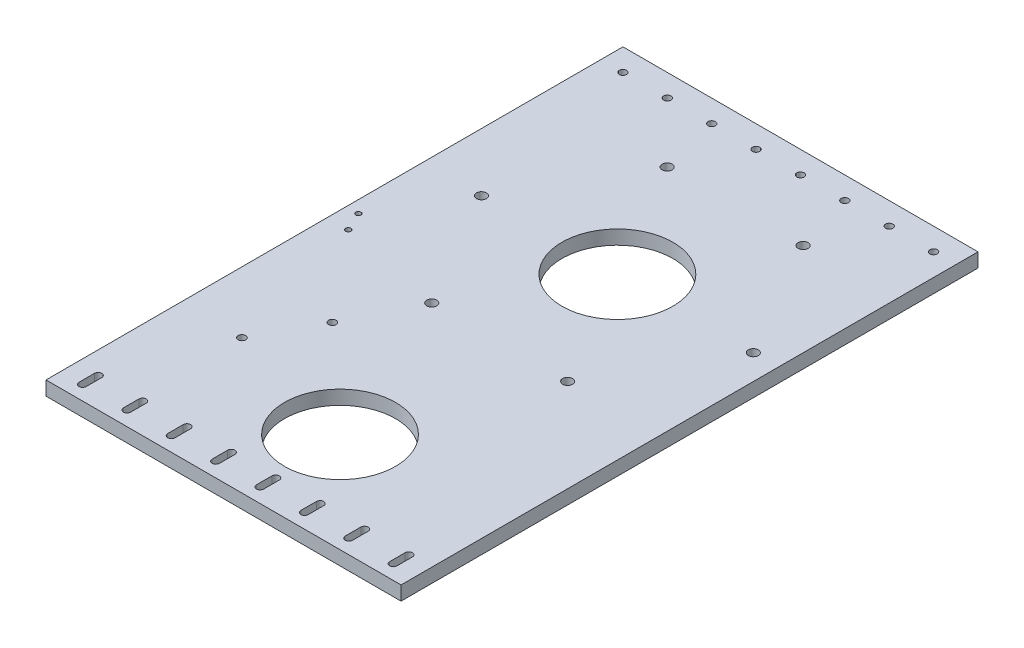
from build123d import *

# Parameters (mm, degrees)
SKETCH1_W           = 160
SKETCH1_H           = 260
SKETCH1_R           = 1.175
SKETCH1_R_2         = 2.25
SKETCH1_R_3         = 25
SKETCH1_R_4         = 1.65
BOSS_EXTRUDE1_DEPTH = 6.35
SKETCH2_R           = 1.7
CUT_EXTRUDE1_DEPTH  = 306.352783678


with BuildPart() as part:
    # Sketch1 → Boss-Extrude1 (new body)
    with BuildSketch(Plane(origin=(0, 0, 0), x_dir=(1, 0, 0), z_dir=(0, 1, 0))):
        with Locations((80, 130)):
            Rectangle(SKETCH1_W, SKETCH1_H)
        with BuildLine():
            ThreePointArc((11.65, 6.5), (10, 4.85), (8.35, 6.5))
            Line((8.35, 6.5), (8.35, 13.5))
            ThreePointArc((8.35, 13.5), (10, 15.15), (11.65, 13.5))
            Line((11.65, 13.5), (11.65, 6.5))
        make_face(mode=Mode.SUBTRACT)
        with BuildLine():
            Line((31.65, 13.5), (31.65, 6.5))
            ThreePointArc((31.65, 6.5), (30, 4.85), (28.35, 6.5))
            Line((28.35, 6.5), (28.35, 13.5))
            ThreePointArc((28.35, 13.5), (30, 15.15), (31.65, 13.5))
        make_face(mode=Mode.SUBTRACT)
        with BuildLine():
            Line((51.65, 13.5), (51.65, 6.5))
            ThreePointArc((51.65, 6.5), (50, 4.85), (48.35, 6.5))
            Line((48.35, 6.5), (48.35, 13.5))
            ThreePointArc((48.35, 13.5), (50, 15.15), (51.65, 13.5))
        make_face(mode=Mode.SUBTRACT)
        with BuildLine():
            Line((71.65, 13.5), (71.65, 6.5))
            ThreePointArc((71.65, 6.5), (70, 4.85), (68.35, 6.5))
            Line((68.35, 6.5), (68.35, 13.5))
            ThreePointArc((68.35, 13.5), (70, 15.15), (71.65, 13.5))
        make_face(mode=Mode.SUBTRACT)
        with Locations((9.516263037, 126.701090269)):
            Circle(SKETCH1_R, mode=Mode.SUBTRACT)
        with Locations((56.875, 116.955944018)):
            Circle(SKETCH1_R_2, mode=Mode.SUBTRACT)
        with BuildLine():
            Line((91.65, 13.5), (91.65, 6.5))
            ThreePointArc((91.65, 6.5), (90, 4.85), (88.35, 6.5))
            Line((88.35, 6.5), (88.35, 13.5))
            ThreePointArc((88.35, 13.5), (90, 15.15), (91.65, 13.5))
        make_face(mode=Mode.SUBTRACT)
        with BuildLine():
            Line((111.65, 13.5), (111.65, 6.5))
            ThreePointArc((111.65, 6.5), (110, 4.85), (108.35, 6.5))
            Line((108.35, 6.5), (108.35, 13.5))
            ThreePointArc((108.35, 13.5), (110, 15.15), (111.65, 13.5))
        make_face(mode=Mode.SUBTRACT)
        with Locations((87.5, 45)):
            Circle(SKETCH1_R_3, mode=Mode.SUBTRACT)
        with BuildLine():
            Line((131.65, 13.5), (131.65, 6.5))
            ThreePointArc((131.65, 6.5), (130, 4.85), (128.35, 6.5))
            Line((128.35, 6.5), (128.35, 13.5))
            ThreePointArc((128.35, 13.5), (130, 15.15), (131.65, 13.5))
        make_face(mode=Mode.SUBTRACT)
        with BuildLine():
            Line((151.65, 13.5), (151.65, 6.5))
            ThreePointArc((151.65, 6.5), (150, 4.85), (148.35, 6.5))
            Line((148.35, 6.5), (148.35, 13.5))
            ThreePointArc((148.35, 13.5), (150, 15.15), (151.65, 13.5))
        make_face(mode=Mode.SUBTRACT)
        with Locations((118.125, 116.955944018)):
            Circle(SKETCH1_R_2, mode=Mode.SUBTRACT)
        with Locations((5.475532842, 135.298909731)):
            Circle(SKETCH1_R, mode=Mode.SUBTRACT)
        with Locations((26.25, 170)):
            Circle(SKETCH1_R_2, mode=Mode.SUBTRACT)
        with Locations((10, 250)):
            Circle(SKETCH1_R_4, mode=Mode.SUBTRACT)
        with Locations((30, 250)):
            Circle(SKETCH1_R_4, mode=Mode.SUBTRACT)
        with Locations((56.875, 223.044055982)):
            Circle(SKETCH1_R_2, mode=Mode.SUBTRACT)
        with Locations((50, 250)):
            Circle(SKETCH1_R_4, mode=Mode.SUBTRACT)
        with Locations((70, 250)):
            Circle(SKETCH1_R_4, mode=Mode.SUBTRACT)
        with Locations((87.5, 170)):
            Circle(SKETCH1_R_3, mode=Mode.SUBTRACT)
        with Locations((148.75, 170)):
            Circle(SKETCH1_R_2, mode=Mode.SUBTRACT)
        with Locations((118.125, 223.044055982)):
            Circle(SKETCH1_R_2, mode=Mode.SUBTRACT)
        with Locations((90, 250)):
            Circle(SKETCH1_R_4, mode=Mode.SUBTRACT)
        with Locations((110, 250)):
            Circle(SKETCH1_R_4, mode=Mode.SUBTRACT)
        with Locations((130, 250)):
            Circle(SKETCH1_R_4, mode=Mode.SUBTRACT)
        with Locations((150, 250)):
            Circle(SKETCH1_R_4, mode=Mode.SUBTRACT)
    extrude(amount=BOSS_EXTRUDE1_DEPTH)

    # Sketch2 → Cut-Extrude1 (cut, through all)
    with BuildSketch(Plane(origin=(0, 6.35, 0), x_dir=(1, 0, 0), z_dir=(0, 1, 0))):
        with Locations((27.663890721, 60.64097268)):
            Circle(SKETCH2_R)
        with Locations((42.063890721, 86.95902732)):
            Circle(SKETCH2_R)
    extrude(amount=-CUT_EXTRUDE1_DEPTH, mode=Mode.SUBTRACT)


solid = part.part
